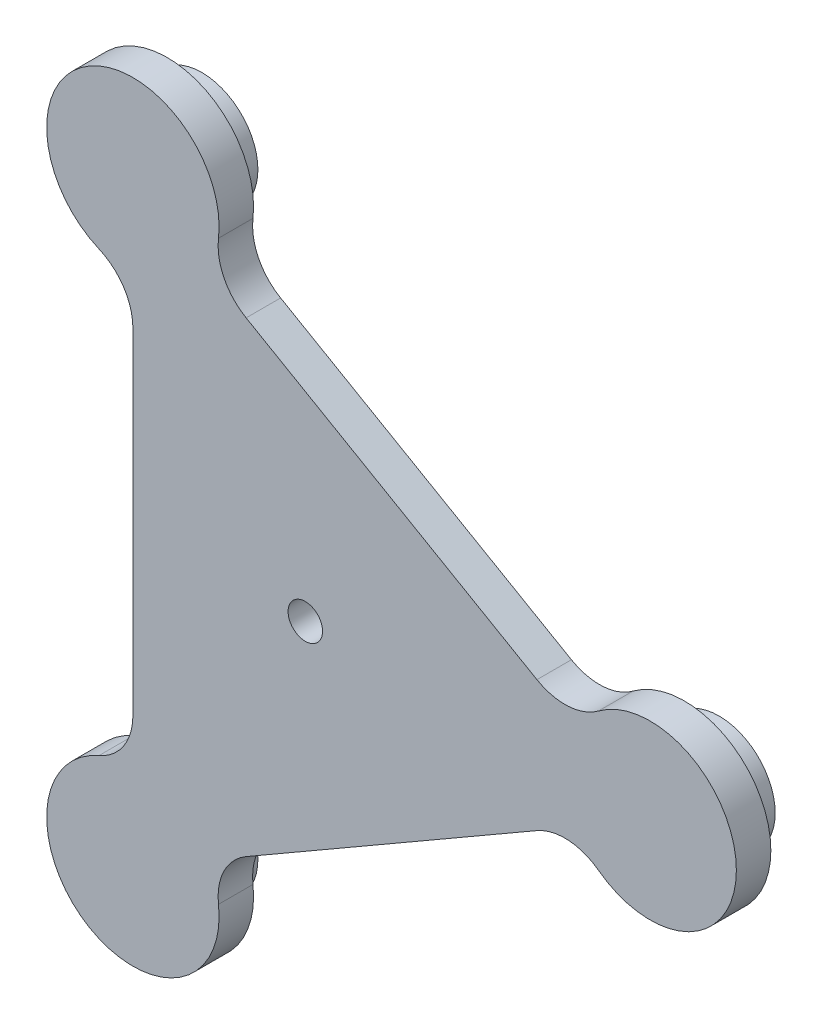
from build123d import *

# Parameters (mm, degrees)
BOSS_EXTRUDE1_DEPTH = 10
SKETCH2_R           = 16.25
BOSS_EXTRUDE2_DEPTH = 10
SKETCH3_R           = 5
CUT_EXTRUDE1_DEPTH  = 10


with BuildPart() as part:
    # Sketch1 → Boss-Extrude1 (new body)
    with BuildSketch(Plane(origin=(0, 0, 0), x_dir=(1, 0, 0), z_dir=(0, 0, -1))):
        with BuildLine():
            ThreePointArc((85.024316237, 20.018260452), (76.253898566, 16.808720932), (67.165147363, 18.95720217))
            Line((67.165147363, 18.95720217), (-17.165182331, 67.645318019))
            ThreePointArc((-17.165182331, 67.645318019), (-23.570200009, 74.442164244), (-25.175869802, 83.642337861))
            ThreePointArc((-25.175869802, 83.642337861), (-62.500004371, 108.253132571), (-59.848480209, 63.624087575))
            ThreePointArc((-59.848480209, 63.624087575), (-52.683728615, 57.63345283), (-49.999992345, 48.68812278))
            Line((-49.999992345, 48.68812278), (-49.999972686, -48.688142969))
            ThreePointArc((-49.999972686, -48.688142969), (-52.683705343, -57.633474102), (-59.848454519, -63.624111741))
            ThreePointArc((-59.848454519, -63.624111741), (-62.49996066, -108.253157807), (-25.175836028, -83.642348027))
            ThreePointArc((-25.175836028, -83.642348027), (-23.570169951, -74.442173761), (-17.165155017, -67.64532495))
            Line((-17.165155017, -67.64532495), (67.165155017, -18.95717505))
            ThreePointArc((67.165155017, -18.95717505), (76.253905353, -16.808690142), (85.02432432, -20.01822612))
            ThreePointArc((85.02432432, -20.01822612), (124.999965031, 2.5237e-05), (85.024316237, 20.018260452))
        make_face()
    extrude(amount=BOSS_EXTRUDE1_DEPTH)

    # Sketch2 → Boss-Extrude2 (add)
    with BuildSketch(Plane(origin=(0, 0, -10), x_dir=(1, 0, 0), z_dir=(0, 0, -1))):
        with Locations((-50, 86.6025)):
            Circle(SKETCH2_R)
        with Locations((99.999965031, 2.0189e-05)):
            Circle(SKETCH2_R)
        with Locations((-49.999965031, -86.602520189)):
            Circle(SKETCH2_R)
    extrude(amount=BOSS_EXTRUDE2_DEPTH)

    # Sketch3 → Cut-Extrude1 (cut)
    with BuildSketch(Plane.XY):
        Circle(SKETCH3_R)
    extrude(amount=-CUT_EXTRUDE1_DEPTH, mode=Mode.SUBTRACT)


solid = part.part
